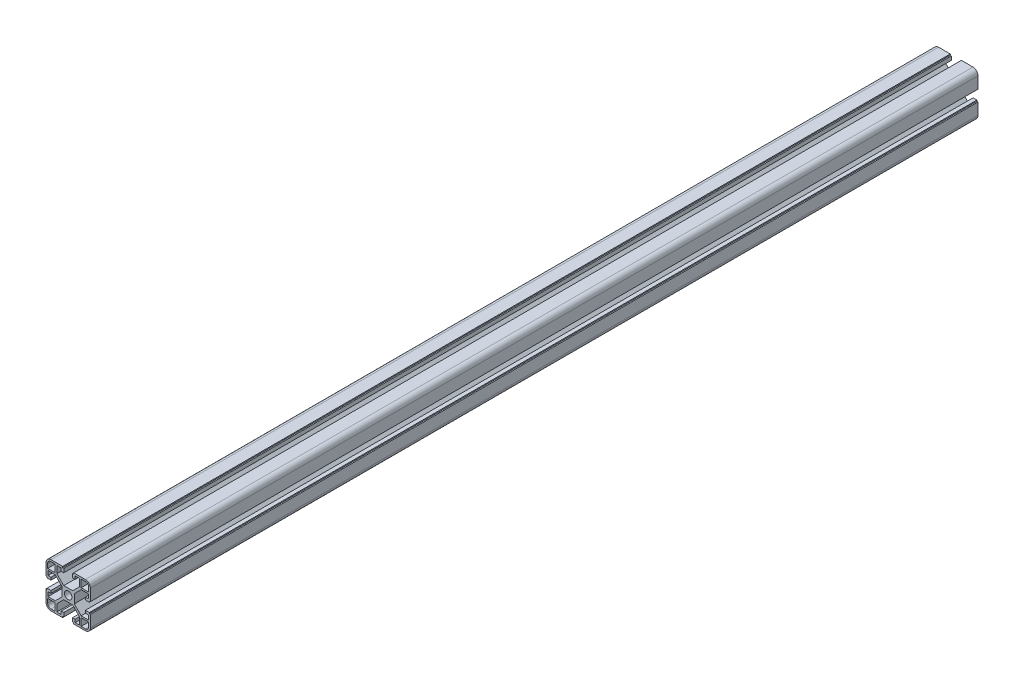
from build123d import *
from build123d.topology import SkipClean

# Parameters (mm, degrees)
BOSS_EXTRUDE1_DEPTH  = 800
MIRROR3_COPY_1_DEPTH = 800
MIRROR3_COPY_2_DEPTH = 800


with BuildPart() as part:
    # Sketch1 → Boss-Extrude1 (new body)
    with BuildSketch(Plane.XY):
        with BuildLine():
            Line((3.4, 0), (5.5, 0))
            Line((5.5, 0), (5.5, 4))
            Line((5.5, 4), (11.69, 10.19))
            Line((11.69, 10.19), (18.2, 10.19))
            Line((18.2, 10.19), (18.2, 6.3))
            Line((18.2, 6.3), (15.5, 6.3))
            Line((15.5, 6.3), (15.5, 4))
            Line((15.5, 4), (19, 4))
            Line((19, 4), (19, 5))
            Line((19, 5), (20, 5))
            Line((20, 5), (20, 15.5))
            ThreePointArc((20, 15.5), (18.681980515, 18.681980515), (15.5, 20))
            Line((15.5, 20), (5, 20))
            Line((5, 20), (5, 19))
            Line((5, 19), (4, 19))
            Line((4, 19), (4, 15.5))
            Line((4, 15.5), (6.3, 15.5))
            Line((6.3, 15.5), (6.3, 18.2))
            Line((6.3, 18.2), (10.19, 18.2))
            Line((10.19, 18.2), (10.19, 11.69))
            Line((10.19, 11.69), (4, 5.5))
            Line((4, 5.5), (0, 5.5))
            Line((0, 5.5), (0, 3.4))
            ThreePointArc((0, 3.4), (2.404163056, 2.404163056), (3.4, 0))
        make_face()
        with BuildLine():
            Line((18.5, 11.69), (18.5, 15.5))
            ThreePointArc((18.5, 15.5), (17.621320344, 17.621320344), (15.5, 18.5))
            Line((15.5, 18.5), (11.69, 18.5))
            Line((11.69, 18.5), (11.69, 11.69))
            Line((11.69, 11.69), (18.5, 11.69))
        make_face(mode=Mode.SUBTRACT)
    boss_extrude1 = extrude(amount=BOSS_EXTRUDE1_DEPTH)

    # Mirror1: Boss-Extrude1 across plane
    add(boss_extrude1.mirror(Plane.ZX))

    # Mirror2: Boss-Extrude1 across plane
    add(boss_extrude1.mirror(Plane(origin=(0, 0, 0), x_dir=(0, 0, 1), z_dir=(1, 0, 0))))

    # Mirror3 copy 1 sketch → Mirror3 copy 1 (add)
    with BuildSketch(Plane(origin=(0, 0, 0), x_dir=(-1, 0, 0), z_dir=(0, 0, 1))):
        with BuildLine():
            Line((3.4, 0), (5.5, 0))
            Line((5.5, 0), (5.5, 4))
            Line((5.5, 4), (11.69, 10.19))
            Line((11.69, 10.19), (18.2, 10.19))
            Line((18.2, 10.19), (18.2, 6.3))
            Line((18.2, 6.3), (15.5, 6.3))
            Line((15.5, 6.3), (15.5, 4))
            Line((15.5, 4), (19, 4))
            Line((19, 4), (19, 5))
            Line((19, 5), (20, 5))
            Line((20, 5), (20, 15.5))
            ThreePointArc((20, 15.5), (18.681980515, 18.681980515), (15.5, 20))
            Line((15.5, 20), (5, 20))
            Line((5, 20), (5, 19))
            Line((5, 19), (4, 19))
            Line((4, 19), (4, 15.5))
            Line((4, 15.5), (6.3, 15.5))
            Line((6.3, 15.5), (6.3, 18.2))
            Line((6.3, 18.2), (10.19, 18.2))
            Line((10.19, 18.2), (10.19, 11.69))
            Line((10.19, 11.69), (4, 5.5))
            Line((4, 5.5), (0, 5.5))
            Line((0, 5.5), (0, 3.4))
            ThreePointArc((0, 3.4), (2.404163056, 2.404163056), (3.4, 0))
        make_face()
        with BuildLine():
            Line((18.5, 11.69), (18.5, 15.5))
            ThreePointArc((18.5, 15.5), (17.621320344, 17.621320344), (15.5, 18.5))
            Line((15.5, 18.5), (11.69, 18.5))
            Line((11.69, 18.5), (11.69, 11.69))
            Line((11.69, 11.69), (18.5, 11.69))
        make_face(mode=Mode.SUBTRACT)
    extrude(amount=MIRROR3_COPY_1_DEPTH)

    # Mirror3 copy 2 sketch → Mirror3 copy 2 (add)
    with SkipClean():  # the faces are left unmerged after this step: merging them gives an invalid solid
        with BuildSketch(Plane.XY):
            with BuildLine():
                Line((3.4, 0), (5.5, 0))
                Line((5.5, 0), (5.5, -4))
                Line((5.5, -4), (11.69, -10.19))
                Line((11.69, -10.19), (18.2, -10.19))
                Line((18.2, -10.19), (18.2, -6.3))
                Line((18.2, -6.3), (15.5, -6.3))
                Line((15.5, -6.3), (15.5, -4))
                Line((15.5, -4), (19, -4))
                Line((19, -4), (19, -5))
                Line((19, -5), (20, -5))
                Line((20, -5), (20, -15.5))
                ThreePointArc((20, -15.5), (18.681980515, -18.681980515), (15.5, -20))
                Line((15.5, -20), (5, -20))
                Line((5, -20), (5, -19))
                Line((5, -19), (4, -19))
                Line((4, -19), (4, -15.5))
                Line((4, -15.5), (6.3, -15.5))
                Line((6.3, -15.5), (6.3, -18.2))
                Line((6.3, -18.2), (10.19, -18.2))
                Line((10.19, -18.2), (10.19, -11.69))
                Line((10.19, -11.69), (4, -5.5))
                Line((4, -5.5), (0, -5.5))
                Line((0, -5.5), (0, -3.4))
                ThreePointArc((0, -3.4), (2.404163056, -2.404163056), (3.4, 0))
            make_face()
            with BuildLine():
                Line((18.5, -11.69), (18.5, -15.5))
                ThreePointArc((18.5, -15.5), (17.621320344, -17.621320344), (15.5, -18.5))
                Line((15.5, -18.5), (11.69, -18.5))
                Line((11.69, -18.5), (11.69, -11.69))
                Line((11.69, -11.69), (18.5, -11.69))
            make_face(mode=Mode.SUBTRACT)
        extrude(amount=MIRROR3_COPY_2_DEPTH)


solid = part.part
